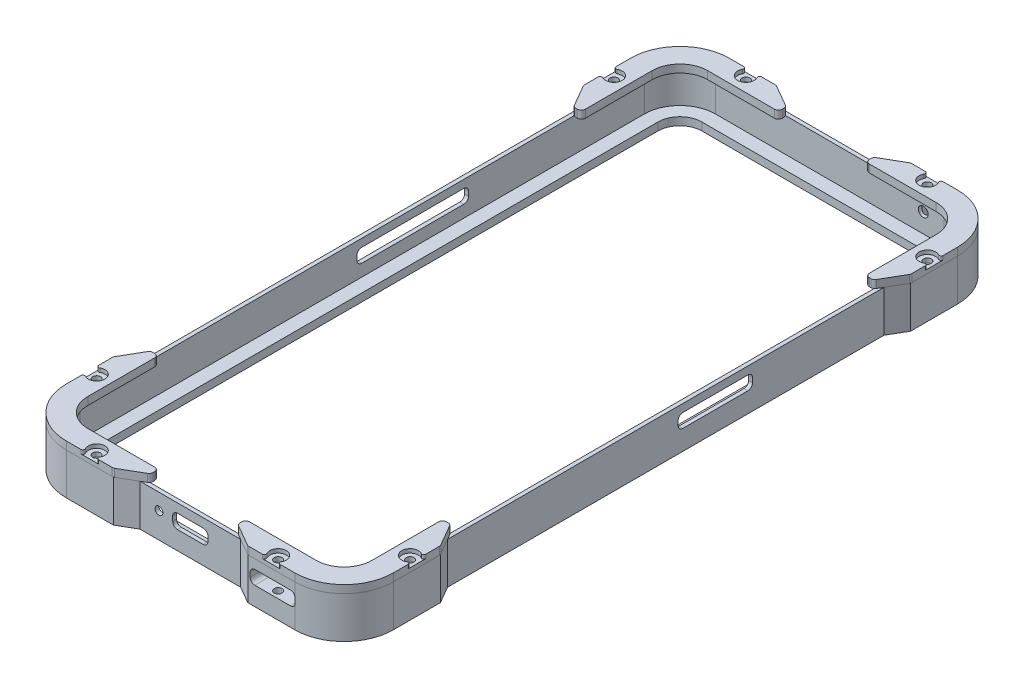
from build123d import *

# Parameters (mm, degrees)
BOSS_EXTRUDE1_DEPTH     = 8.6
BOSS_EXTRUDE2_START     = -2
BOSS_EXTRUDE2_DEPTH     = 2
BOSS_EXTRUDE3_START     = -10.6
BOSS_EXTRUDE3_DEPTH     = 10.6
SKETCH4_R               = 1
BOSS_EXTRUDE4_DEPTH     = 2
SKETCH5_R               = 2.1
CUT_EXTRUDE3_DEPTH      = 1
SKETCH4_3_R             = 1
CUT_EXTRUDE4_DEPTH      = 9
FILLET1_R               = 0.5
FILLET2_R               = 1
MIRROR2_START           = -10.6
MIRROR2_COPY_1_DEPTH    = 10.6
MIRROR2_COPY_2_SKETCH_R = 1
MIRROR2_COPY_2_DEPTH    = 9
SKETCH6_W               = 19
SKETCH6_H               = 3.5
CUT_EXTRUDE5_DEPTH      = 1
SKETCH7_R               = 1
SKETCH7_W               = 9
SKETCH7_H               = 3.6
CUT_EXTRUDE9_DEPTH      = 1
CUT_EXTRUDE10_START     = -1.000549
SKETCH7_3_W             = 11.5
SKETCH7_3_H             = 3.5
CUT_EXTRUDE10_DEPTH     = 3.500549
SKETCH8_W               = 28.5
SKETCH8_H               = 3.5
CUT_EXTRUDE11_DEPTH     = 1
CUT_EXTRUDE12_START     = -3.5
SKETCH9_R               = 1.25
CUT_EXTRUDE12_DEPTH     = 3.5
FILLET3_START           = -39.275
FILLET3_DEPTH           = 1
FILLET3_START_2         = 38.275
FILLET3_2_DEPTH         = 1
FILLET3_START_3         = 81.165
FILLET3_3_DEPTH         = 3.499603168
FILLET3_4_DEPTH         = 1
FILLET3_START_4         = 84.324536559
FILLET3_5_DEPTH         = 0.340463441


with BuildPart() as part:
    # Sketch2 → Boss-Extrude1 (new body)
    with BuildSketch(Plane(origin=(0, 0, 0), x_dir=(1, 0, 0), z_dir=(0, 1, 0))):
        with BuildLine():
            Line((29.175, 82.165), (-29.175, 82.165))
            ThreePointArc((-29.175, 82.165), (-36.31677849, 79.20677849), (-39.275, 72.065))
            Line((-39.275, 72.065), (-39.275, -72.065))
            ThreePointArc((-39.275, -72.065), (-36.31677849, -79.20677849), (-29.175, -82.165))
            Line((-29.175, -82.165), (29.175, -82.165))
            ThreePointArc((29.175, -82.165), (36.31677849, -79.20677849), (39.275, -72.065))
            Line((39.275, -72.065), (39.275, 72.065))
            ThreePointArc((39.275, 72.065), (36.31677849, 79.20677849), (29.175, 82.165))
        make_face()
        with BuildLine():
            ThreePointArc((38.275, 72.065), (35.609671709, 78.499671709), (29.175, 81.165))
            Line((29.175, 81.165), (-29.175, 81.165))
            ThreePointArc((-29.175, 81.165), (-35.609671709, 78.499671709), (-38.275, 72.065))
            Line((-38.275, 72.065), (-38.275, -72.065))
            ThreePointArc((-38.275, -72.065), (-35.609671709, -78.499671709), (-29.175, -81.165))
            Line((-29.175, -81.165), (29.175, -81.165))
            ThreePointArc((29.175, -81.165), (35.609671709, -78.499671709), (38.275, -72.065))
            Line((38.275, -72.065), (38.275, 72.065))
        make_face(mode=Mode.SUBTRACT)
    extrude(amount=BOSS_EXTRUDE1_DEPTH)

    # Sketch2<3> → Boss-Extrude2 (add)
    with BuildSketch(Plane(origin=(0, 0, 0), x_dir=(1, 0, 0), z_dir=(0, 1, 0)).offset(BOSS_EXTRUDE2_START)):
        with BuildLine():
            Line((-29.175, -82.165), (29.175, -82.165))
            ThreePointArc((29.175, -82.165), (36.31677849, -79.20677849), (39.275, -72.065))
            Line((39.275, -72.065), (39.275, 72.065))
            ThreePointArc((39.275, 72.065), (36.31677849, 79.20677849), (29.175, 82.165))
            Line((29.175, 82.165), (-29.175, 82.165))
            ThreePointArc((-29.175, 82.165), (-36.31677849, 79.20677849), (-39.275, 72.065))
            Line((-39.275, 72.065), (-39.275, -72.065))
            ThreePointArc((-39.275, -72.065), (-36.31677849, -79.20677849), (-29.175, -82.165))
        make_face()
        with BuildLine():
            Line((-29.175, -77.665), (29.175, -77.665))
            ThreePointArc((29.175, -77.665), (33.134797975, -76.024797975), (34.775, -72.065))
            Line((34.775, -72.065), (34.775, 72.065))
            ThreePointArc((34.775, 72.065), (33.134797975, 76.024797975), (29.175, 77.665))
            Line((29.175, 77.665), (-29.175, 77.665))
            ThreePointArc((-29.175, 77.665), (-33.134797975, 76.024797975), (-34.775, 72.065))
            Line((-34.775, 72.065), (-34.775, -72.065))
            ThreePointArc((-34.775, -72.065), (-33.134797975, -76.024797975), (-29.175, -77.665))
        make_face(mode=Mode.SUBTRACT)
    extrude(amount=BOSS_EXTRUDE2_DEPTH)

    # Sketch3 → Boss-Extrude3 (add)
    with BuildSketch(Plane(origin=(0, 8.6, 0), x_dir=(1, 0, 0), z_dir=(0, 1, 0)).offset(BOSS_EXTRUDE3_START)):
        with BuildLine():
            Line((-12.844872981, 82.165), (-17.175, 84.665))
            Line((-17.175, 84.665), (-29.175, 84.665))
            ThreePointArc((-29.175, 84.665), (-38.084545443, 80.974545443), (-41.775, 72.065))
            Line((-41.775, 72.065), (-41.775, 60.065))
            Line((-41.775, 60.065), (-39.275, 55.734872981))
            Line((-39.275, 55.734872981), (-39.275, 72.065))
            ThreePointArc((-39.275, 72.065), (-36.31677849, 79.20677849), (-29.175, 82.165))
            Line((-29.175, 82.165), (-12.844872981, 82.165))
        make_face()
    boss_extrude3 = extrude(amount=BOSS_EXTRUDE3_DEPTH)

    # Sketch4<3> → Cut-Extrude4 (cut)
    with BuildSketch(Plane(origin=(0, 8.6, 0), x_dir=(1, 0, 0), z_dir=(0, 1, 0))):
        with Locations(Location((-40.025, 66.065, 0), (0, 0, 270))):
            Circle(SKETCH4_3_R)
        with Locations(Location((-23.175, 82.915, 0), (0, 0, 270))):
            Circle(SKETCH4_3_R)
    cut_extrude4 = extrude(amount=-CUT_EXTRUDE4_DEPTH, mode=Mode.SUBTRACT)

    # Mirror1: Boss-Extrude3, Cut-Extrude4 across plane
    add(boss_extrude3.mirror(Plane(origin=(0, 0, 0), x_dir=(0, 0, 1), z_dir=(1, 0, 0))))
    add(cut_extrude4.mirror(Plane(origin=(0, 0, 0), x_dir=(0, 0, 1), z_dir=(1, 0, 0))), mode=Mode.SUBTRACT)

    # Mirror2: Boss-Extrude3, Cut-Extrude4 across plane
    add(boss_extrude3.mirror(Plane.XY))
    add(cut_extrude4.mirror(Plane.XY), mode=Mode.SUBTRACT)

    # Mirror2 copy 1 sketch → Mirror2 copy 1 (add)
    with BuildSketch(Plane(origin=(0, 8.6, 0), x_dir=(-1, 0, 0), z_dir=(0, 1, 0)).offset(MIRROR2_START)):
        with BuildLine():
            Line((-12.844872981, 82.165), (-17.175, 84.665))
            Line((-17.175, 84.665), (-29.175, 84.665))
            ThreePointArc((-29.175, 84.665), (-38.084545443, 80.974545443), (-41.775, 72.065))
            Line((-41.775, 72.065), (-41.775, 60.065))
            Line((-41.775, 60.065), (-39.275, 55.734872981))
            Line((-39.275, 55.734872981), (-39.275, 72.065))
            ThreePointArc((-39.275, 72.065), (-36.31677849, 79.20677849), (-29.175, 82.165))
            Line((-29.175, 82.165), (-12.844872981, 82.165))
        make_face()
    extrude(amount=MIRROR2_COPY_1_DEPTH)

    # Mirror2 copy 2 sketch → Mirror2 copy 2 (cut)
    with BuildSketch(Plane(origin=(0, 8.6, 0), x_dir=(-1, 0, 0), z_dir=(0, 1, 0))):
        with Locations(Location((-40.025, 66.065, 0), (0, 0, 270))):
            Circle(MIRROR2_COPY_2_SKETCH_R)
        with Locations(Location((-23.175, 82.915, 0), (0, 0, 270))):
            Circle(MIRROR2_COPY_2_SKETCH_R)
    extrude(amount=-MIRROR2_COPY_2_DEPTH, mode=Mode.SUBTRACT)

    # Sketch6 → Cut-Extrude5 (cut)
    with BuildSketch(Plane(origin=(39.275, 0, 0), x_dir=(0, 0, -1), z_dir=(1, 0, 0))):
        with Locations((12.665, 4.85)):
            Rectangle(SKETCH6_W, SKETCH6_H)
    extrude(amount=-CUT_EXTRUDE5_DEPTH, mode=Mode.SUBTRACT)

    # Sketch7 → Cut-Extrude9 (cut)
    with BuildSketch(Plane.XY.offset(82.165)):
        with Locations((-8, 4.5)):
            Circle(SKETCH7_R)
        with Locations((0, 4.5)):
            Rectangle(SKETCH7_W, SKETCH7_H)
    extrude(amount=-CUT_EXTRUDE9_DEPTH, mode=Mode.SUBTRACT)

    # Sketch7<3> → Cut-Extrude10 (cut)
    with BuildSketch(Plane.XY.offset(82.165).offset(CUT_EXTRUDE10_START)):
        with Locations((23.525, 4.5)):
            Rectangle(SKETCH7_3_W, SKETCH7_3_H)
    extrude(amount=CUT_EXTRUDE10_DEPTH, mode=Mode.SUBTRACT)

    # Sketch8 → Cut-Extrude11 (cut)
    with BuildSketch(Plane.ZY.offset(39.275)):
        with Locations((-12.915, 4.85)):
            Rectangle(SKETCH8_W, SKETCH8_H)
    extrude(amount=-CUT_EXTRUDE11_DEPTH, mode=Mode.SUBTRACT)

    # Sketch9 → Cut-Extrude12 (cut)
    with BuildSketch(Plane(origin=(0, 0, -84.665), x_dir=(-1, 0, 0), z_dir=(0, 0, -1)).offset(CUT_EXTRUDE12_START)):
        with Locations((-23.875, 4.9)):
            Circle(SKETCH9_R)
    extrude(amount=CUT_EXTRUDE12_DEPTH, mode=Mode.SUBTRACT)

    # Fillet3: read off the stored shape, not the designer's step
    # Fillet3 outline → Fillet3 (add)
    with BuildSketch(Plane.YZ.offset(FILLET3_START)):
        with BuildLine():
            ThreePointArc((5.4, 1.335), (6.248528137, 0.983528137), (6.6, 0.135))
            Line((6.6, 0.135), (6.6, 1.335))
            Line((6.6, 1.335), (5.4, 1.335))
        make_face()
        with BuildLine():
            Line((3.1, 1.335), (3.1, 0.135))
            ThreePointArc((3.1, 0.135), (3.451471863, 0.983528137), (4.3, 1.335))
            Line((4.3, 1.335), (3.1, 1.335))
        make_face()
        with BuildLine():
            Line((6.6, -27.165), (6.6, -25.965))
            ThreePointArc((6.6, -25.965), (6.248528137, -26.813528137), (5.4, -27.165))
            Line((5.4, -27.165), (6.6, -27.165))
        make_face()
        with BuildLine():
            ThreePointArc((4.3, -27.165), (3.451471863, -26.813528137), (3.1, -25.965))
            Line((3.1, -25.965), (3.1, -27.165))
            Line((3.1, -27.165), (4.3, -27.165))
        make_face()
    extrude(amount=FILLET3_DEPTH)

    # Fillet3 2 outline → Fillet3 2 (add)
    with BuildSketch(Plane.YZ.offset(FILLET3_START_2)):
        with BuildLine():
            Line((6.6, -3.165), (5.4, -3.165))
            ThreePointArc((5.4, -3.165), (6.248528137, -3.516471863), (6.6, -4.365))
            Line((6.6, -4.365), (6.6, -3.165))
        make_face()
        with BuildLine():
            ThreePointArc((3.1, -4.365), (3.451471863, -3.516471863), (4.3, -3.165))
            Line((4.3, -3.165), (3.1, -3.165))
            Line((3.1, -3.165), (3.1, -4.365))
        make_face()
        with BuildLine():
            Line((6.6, -22.165), (6.6, -20.965))
            ThreePointArc((6.6, -20.965), (6.248528137, -21.813528137), (5.4, -22.165))
            Line((5.4, -22.165), (6.6, -22.165))
        make_face()
        with BuildLine():
            ThreePointArc((4.3, -22.165), (3.451471863, -21.813528137), (3.1, -20.965))
            Line((3.1, -20.965), (3.1, -22.165))
            Line((3.1, -22.165), (4.3, -22.165))
        make_face()
    extrude(amount=FILLET3_2_DEPTH)

    # Fillet3 3 outline → Fillet3 3 (add)
    with BuildSketch(Plane.XY.offset(FILLET3_START_3)):
        with BuildLine():
            ThreePointArc((18.975, 2.75), (18.126471863, 3.101471863), (17.775, 3.95))
            Line((17.775, 3.95), (17.775, 2.75))
            Line((17.775, 2.75), (18.975, 2.75))
        make_face()
        with BuildLine():
            Line((17.775, 6.25), (17.775, 5.05))
            ThreePointArc((17.775, 5.05), (18.126471863, 5.898528137), (18.975, 6.25))
            Line((18.975, 6.25), (17.775, 6.25))
        make_face()
        with BuildLine():
            ThreePointArc((29.275, 3.95), (28.923528137, 3.101471863), (28.075, 2.75))
            Line((28.075, 2.75), (29.275, 2.75))
            Line((29.275, 2.75), (29.275, 3.95))
        make_face()
        with BuildLine():
            Line((29.275, 6.25), (28.075, 6.25))
            ThreePointArc((28.075, 6.25), (28.923528137, 5.898528137), (29.275, 5.05))
            Line((29.275, 5.05), (29.275, 6.25))
        make_face()
    extrude(amount=FILLET3_3_DEPTH)

    # Fillet3 4 outline → Fillet3 4 (add)
    with BuildSketch(Plane.XY.offset(FILLET3_START_3)):
        with BuildLine():
            ThreePointArc((-4.5, 5.1), (-4.148528137, 5.948528137), (-3.3, 6.3))
            Line((-3.3, 6.3), (-4.5, 6.3))
            Line((-4.5, 6.3), (-4.5, 5.1))
        make_face()
        with BuildLine():
            Line((4.5, 6.3), (3.3, 6.3))
            ThreePointArc((3.3, 6.3), (4.148528137, 5.948528137), (4.5, 5.1))
            Line((4.5, 5.1), (4.5, 6.3))
        make_face()
        with BuildLine():
            ThreePointArc((-3.3, 2.7), (-4.148528137, 3.051471863), (-4.5, 3.9))
            Line((-4.5, 3.9), (-4.5, 2.7))
            Line((-4.5, 2.7), (-3.3, 2.7))
        make_face()
        with BuildLine():
            Line((4.5, 2.7), (4.5, 3.9))
            ThreePointArc((4.5, 3.9), (4.148528137, 3.051471863), (3.3, 2.7))
            Line((3.3, 2.7), (4.5, 2.7))
        make_face()
    extrude(amount=FILLET3_4_DEPTH)

    # Fillet3 5 outline → Fillet3 5 (add)
    with BuildSketch(Plane.XY.offset(FILLET3_START_4)):
        with BuildLine():
            ThreePointArc((18.975, 2.75), (18.126471863, 3.101471863), (17.775, 3.95))
            Line((17.775, 3.95), (17.775, 2.75))
            Line((17.775, 2.75), (18.975, 2.75))
        make_face()
        with BuildLine():
            Line((17.775, 6.25), (17.775, 5.05))
            ThreePointArc((17.775, 5.05), (18.126471863, 5.898528137), (18.975, 6.25))
            Line((18.975, 6.25), (17.775, 6.25))
        make_face()
    extrude(amount=FILLET3_5_DEPTH)


with BuildPart() as body_2:
    # Sketch4 → Boss-Extrude4 (new body)
    with BuildSketch(Plane(origin=(0, 8.6, 0), x_dir=(1, 0, 0), z_dir=(0, 1, 0))):
        with BuildLine():
            Line((-39.275, 55.734872981), (-38.275, 54.002822174))
            Line((-38.275, 54.002822174), (-36.275, 54.002822174))
            Line((-36.275, 54.002822174), (-36.275, 72.065))
            ThreePointArc((-36.275, 72.065), (-34.195458146, 77.085458146), (-29.175, 79.165))
            Line((-29.175, 79.165), (-11.112822174, 79.165))
            Line((-11.112822174, 79.165), (-11.112822174, 81.165))
            Line((-11.112822174, 81.165), (-12.844872981, 82.165))
            Line((-12.844872981, 82.165), (-17.175, 84.665))
            Line((-17.175, 84.665), (-29.175, 84.665))
            ThreePointArc((-29.175, 84.665), (-38.084545443, 80.974545443), (-41.775, 72.065))
            Line((-41.775, 72.065), (-41.775, 60.065))
            Line((-41.775, 60.065), (-39.275, 55.734872981))
        make_face()
        with Locations(Location((-40.025, 66.065, 0), (0, 0, 270))):
            Circle(SKETCH4_R, mode=Mode.SUBTRACT)
        with Locations(Location((-23.175, 82.915, 0), (0, 0, 270))):
            Circle(SKETCH4_R, mode=Mode.SUBTRACT)
    extrude(amount=BOSS_EXTRUDE4_DEPTH)

    # Sketch5 → Cut-Extrude3 (cut)
    with BuildSketch(Plane(origin=(0, 10.6, 0), x_dir=(1, 0, 0), z_dir=(0, 1, 0))):
        with Locations((-40.025, 66.065)):
            Circle(SKETCH5_R)
        with Locations((-23.175, 82.915)):
            Circle(SKETCH5_R)
    extrude(amount=-CUT_EXTRUDE3_DEPTH, mode=Mode.SUBTRACT)

    # Fillet1
    fillet1_edges = [body_2.edges().sort_by_distance(p)[0] for p in [
        (-24.335818677, 10.1, -84.665),
        (-22.014181323, 10.1, -84.665),
        (-41.775, 10.1, -64.904181323),
        (-41.775, 10.1, -67.225818677),
    ]]
    fillet(fillet1_edges, radius=FILLET1_R)

    # Fillet2
    fillet2_edges = [body_2.edges().sort_by_distance(p)[0] for p in [
        (-17.175, 9.6, -84.665),
        (-11.112822174, 9.6, -81.165),
        (-11.112822174, 9.6, -79.165),
        (-36.275, 9.6, -54.002822174),
        (-38.275, 9.6, -54.002822174),
        (-41.775, 9.6, -60.065),
    ]]
    fillet(fillet2_edges, radius=FILLET2_R)


with BuildPart() as body_3:
    # Mirror4: mirrored copy
    add(body_2.part.mirror(Plane(origin=(0, 0, 0), x_dir=(0, 0, 1), z_dir=(1, 0, 0))))


with BuildPart() as body_4:
    # Mirror5: mirrored copy
    add(body_2.part.mirror(Plane.XY))


with BuildPart() as body_5:
    # Mirror5 2: mirrored copy
    add(body_3.part.mirror(Plane.XY))


solid = Compound([part.part, body_2.part, body_3.part, body_4.part, body_5.part])
